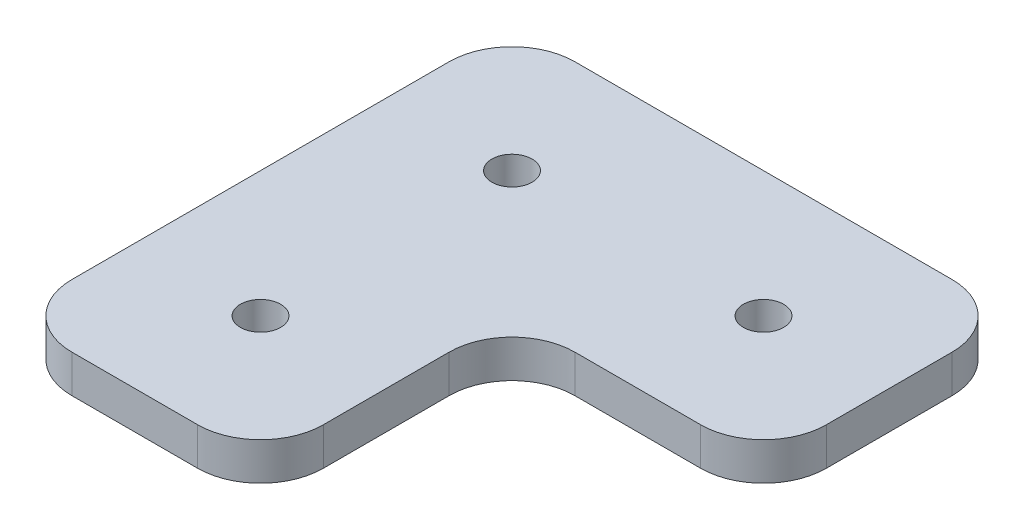
from build123d import *

# Parameters (mm, degrees)
SKETCH_1_R      = 1.6
EXTRUDE_1_DEPTH = 3
FILLET_1_R      = 5


with BuildPart() as part:
    # 草图1 → 凸台-拉伸1 (new body)
    with BuildSketch(Plane(origin=(0, 0, 0), x_dir=(1, 0, 0), z_dir=(0, 1, 0))):
        Polygon((0, 0), (0, 40), (40, 40), (40, 20), (20, 20), (20, 0), align=None)
        with Locations((30, 30)):
            Circle(SKETCH_1_R, mode=Mode.SUBTRACT)
        with Locations((10, 30)):
            Circle(SKETCH_1_R, mode=Mode.SUBTRACT)
        with Locations((10, 10)):
            Circle(SKETCH_1_R, mode=Mode.SUBTRACT)
    extrude(amount=EXTRUDE_1_DEPTH)

    # 圆角1
    fillet_1_edges = [part.edges().sort_by_distance(p)[0] for p in [
        (0, 1.5, 0),
        (20, 1.5, 0),
        (40, 1.5, -20),
        (40, 1.5, -40),
        (0, 1.5, -40),
        (20, 1.5, -20),
    ]]
    fillet(fillet_1_edges, radius=FILLET_1_R)


solid = part.part
